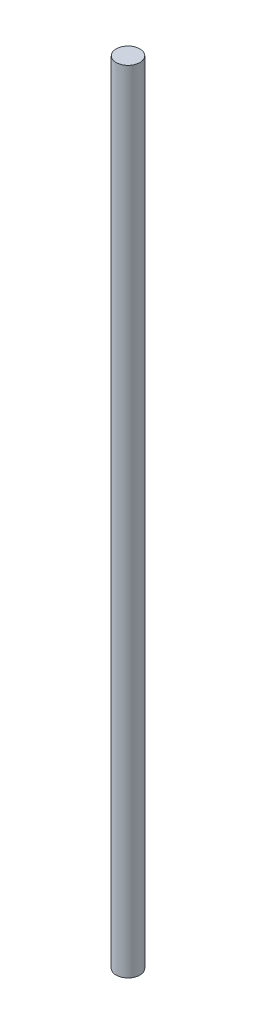
from build123d import *

# Parameters (mm, degrees)
SKETCH1_R           = 3
BOSS_EXTRUDE1_DEPTH = 100


with BuildPart() as part:
    # Sketch1 → Boss-Extrude1 (new, symmetric)
    with BuildSketch(Plane(origin=(0, 0, 0), x_dir=(1, 0, 0), z_dir=(0, 1, 0))):
        Circle(SKETCH1_R)
    extrude(amount=BOSS_EXTRUDE1_DEPTH, both=True)


solid = part.part
